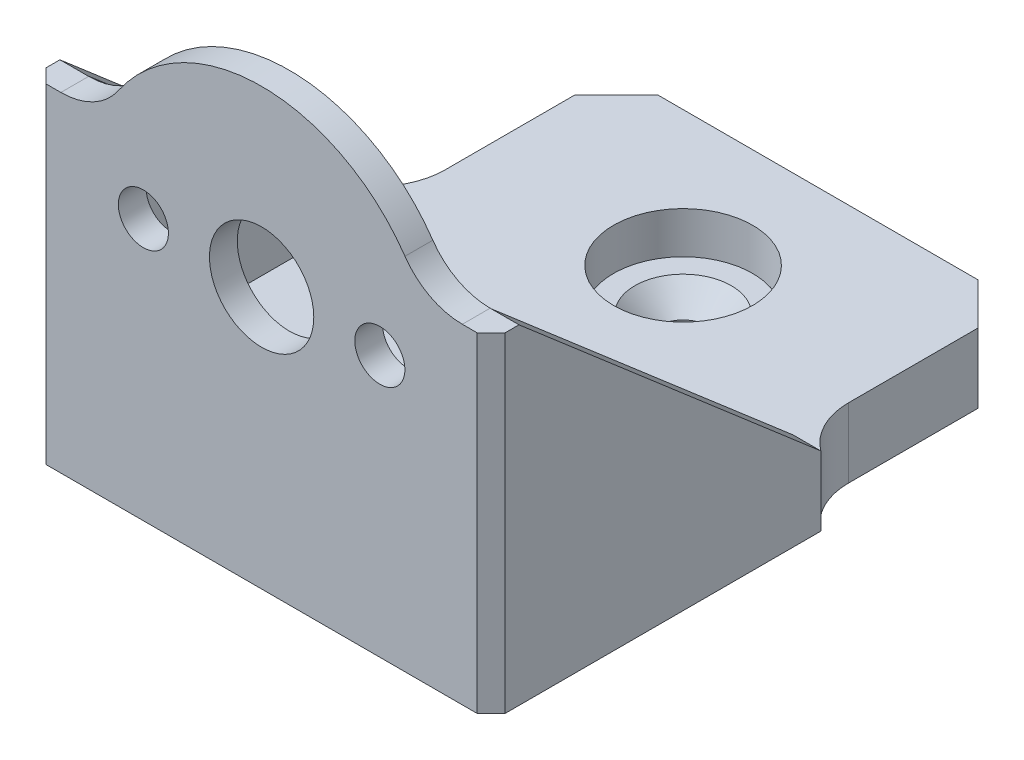
from build123d import *

# Parameters (mm, degrees)
SKETCH1_W                                    = 23
SKETCH1_H                                    = 40
SKETCH1_R                                    = 1.75
BOSS_EXTRUDE1_DEPTH                          = 5
SKETCH2_W                                    = 23
SKETCH2_H                                    = 2
BOSS_EXTRUDE2_DEPTH                          = 50
SKETCH3_R                                    = 1.8
SKETCH3_R_2                                  = 3.75
CUT_EXTRUDE1_DEPTH                           = 69.972820734
BOSS_EXTRUDE3_DEPTH                          = 3
BOSS_EXTRUDE4_START                          = -23
BOSS_EXTRUDE4_DEPTH                          = 3
BOSS_EXTRUDE5_DEPTH                          = 2
BOSS_EXTRUDE6_START                          = -29
BOSS_EXTRUDE6_DEPTH                          = 2
SKETCH6_R                                    = 5
CUT_EXTRUDE2_DEPTH                           = 3
CSK_FOR_M3_HEX_SOCKET_COUNTERSUNK_HE_2_COUNT = 2
CSK_FOR_M3_HEX_SOCKET_COUNTERSUNK_HE_2_PITCH = 20
CHAMFER1_SIZE                                = 3
CHAMFER2_SIZE                                = 1
FILLET1_R                                    = 5


with BuildPart() as part:
    # Sketch1 → Boss-Extrude1 (new body)
    with BuildSketch(Plane(origin=(0, 0, 0), x_dir=(1, 0, 0), z_dir=(0, 1, 0))):
        with Locations((0, -10.3)):
            Rectangle(SKETCH1_W, SKETCH1_H)
        with Locations(Location((0, 0, 0), (0, 0, 270))):
            Circle(SKETCH1_R, mode=Mode.SUBTRACT)
        with Locations(Location((0, -20, 0), (0, 0, 270))):
            Circle(SKETCH1_R, mode=Mode.SUBTRACT)
    extrude(amount=BOSS_EXTRUDE1_DEPTH)

    # Sketch2 → Boss-Extrude2 (add)
    with BuildSketch(Plane(origin=(0, 5, 0), x_dir=(1, 0, 0), z_dir=(0, 1, 0))):
        with Locations((0, -29.3)):
            Rectangle(SKETCH2_W, SKETCH2_H)
    extrude(amount=BOSS_EXTRUDE2_DEPTH)

    # Sketch3 → Cut-Extrude1 (cut, through all)
    with BuildSketch(Plane.XY.offset(30.3)):
        with Locations((-8.5, 18.8)):
            Circle(SKETCH3_R)
        with Locations((8.5, 18.8)):
            Circle(SKETCH3_R)
        with Locations((0, 18.8)):
            Circle(SKETCH3_R_2)
        with BuildLine():
            Line((-11.5, 23.698979486), (-11.5, 55))
            Line((-11.5, 55), (11.5, 55))
            Line((11.5, 55), (11.5, 23.698979486))
            ThreePointArc((11.5, 23.698979486), (0, 31.3), (-11.5, 23.698979486))
        make_face()
    extrude(amount=-CUT_EXTRUDE1_DEPTH, mode=Mode.SUBTRACT)

    # Sketch4 → Boss-Extrude3 (add)
    with BuildSketch(Plane.ZY.offset(11.5)):
        Polygon((30.3, 0), (30.3, 23.698979486), (28.3, 23.698979486), (28.3, 5), (-9.7, 5), (-9.7, 0), align=None)
    extrude(amount=BOSS_EXTRUDE3_DEPTH)

    # Sketch4<2> → Boss-Extrude4 (add)
    with BuildSketch(Plane.ZY.offset(11.5).offset(BOSS_EXTRUDE4_START)):
        Polygon((30.3, 0), (30.3, 23.698979486), (28.3, 23.698979486), (28.3, 5), (-9.7, 5), (-9.7, 0), align=None)
    extrude(amount=-BOSS_EXTRUDE4_DEPTH)

    # Sketch5 → Boss-Extrude5 (add)
    with BuildSketch(Plane(origin=(14.5, 0, 0), x_dir=(0, 0, -1), z_dir=(1, 0, 0))):
        Polygon((-30.3, 23.698979486), (-30.3, 0), (-6.601020514, 0), (-6.601020514, 5), (-28.3, 23.698979486), align=None)
    extrude(amount=BOSS_EXTRUDE5_DEPTH)

    # Sketch5<2> → Boss-Extrude6 (add)
    with BuildSketch(Plane(origin=(14.5, 0, 0), x_dir=(0, 0, -1), z_dir=(1, 0, 0)).offset(BOSS_EXTRUDE6_START)):
        Polygon((-30.3, 23.698979486), (-30.3, 0), (-6.601020514, 0), (-6.601020514, 5), (-28.3, 23.698979486), align=None)
    extrude(amount=-BOSS_EXTRUDE6_DEPTH)

    # Sketch6 → Cut-Extrude2 (cut)
    with BuildSketch(Plane(origin=(0, 5, 0), x_dir=(1, 0, 0), z_dir=(0, 1, 0))):
        with Locations(Location((0, 0, 0), (0, 0, 270))):
            Circle(SKETCH6_R)
        with Locations(Location((0, -20, 0), (0, 0, 270))):
            Circle(SKETCH6_R)
    extrude(amount=-CUT_EXTRUDE2_DEPTH, mode=Mode.SUBTRACT)

    # Sketch8 → CSK for M3 Hex Socket Countersunk Head Screw1 (revolve, cut)
    with BuildSketch(Plane(origin=(0, 2, 0), x_dir=(0, 0, 1), z_dir=(1, 0, 0))):
        Polygon((0, 0), (0, 2), (1.8, 2), (1.8, 1.67), (3.47, 0), align=None)
    csk_for_m3_hex_socket_countersunk_head_s = revolve(axis=Axis((0, 8.35, 0), (0, -1, 0)), mode=Mode.SUBTRACT)

    # CSK for M3 Hex Socket Countersunk He 2: CSK for M3 Hex Socket Countersunk Head Screw1 ×2
    with Locations(*[(0, 0, i * CSK_FOR_M3_HEX_SOCKET_COUNTERSUNK_HE_2_PITCH) for i in range(1, CSK_FOR_M3_HEX_SOCKET_COUNTERSUNK_HE_2_COUNT)]):
        add(csk_for_m3_hex_socket_countersunk_head_s, mode=Mode.SUBTRACT)

    # Chamfer1
    chamfer1_edges = [part.edges().sort_by_distance(p)[0] for p in [
        (-14.5, 2.5, -9.7),
        (14.5, 2.5, -9.7),
    ]]
    chamfer(chamfer1_edges, length=CHAMFER1_SIZE)

    # Chamfer2
    chamfer2_edges = [part.edges().sort_by_distance(p)[0] for p in [
        (16.5, 11.849489743, 30.3),
        (-16.5, 11.849489743, 30.3),
    ]]
    chamfer(chamfer2_edges, length=CHAMFER2_SIZE)

    # Fillet1
    # the kernel refuses this fillet: 5 mm, written as the material it adds along each edge
    with BuildSketch(Plane(origin=(11.5, 23.698979486, 30.3), x_dir=(1, 0, 0), z_dir=(0, 0, -1))) as fillet1_piece_1:
        with BuildLine():
            CenterArc((2.931223273, -5), FILLET1_R, 90, 55.552144514)
            ThreePointArc((-1.191983377, -2.171720147), (-0.54205816, -1.115462354), (0, 0))
            Line((0, 0), (2.931223273, 0))
        make_face()
    extrude(amount=2)
    with BuildSketch(Plane(origin=(-11.5, 23.698979486, 30.3), x_dir=(-1, 0, 0), z_dir=(0, 0, -1))) as fillet1_piece_2:
        with BuildLine():
            CenterArc((2.931223273, 5), FILLET1_R, 214.447855486, 55.552144514)
            ThreePointArc((-1.191983377, 2.171720147), (-0.54205816, 1.115462354), (0, 0))
            Line((0, 0), (2.931223273, 0))
        make_face()
    extrude(amount=2)
    with BuildSketch(Plane(origin=(-14.5, 0, 6.601020514), x_dir=(-1, 0, 0), z_dir=(0, 1, 0))) as fillet1_piece_3:
        with BuildLine():
            CenterArc((5, -4), FILLET1_R, 126.869897646, 53.130102354)
            Line((0, -4), (0, 0))
            Line((0, 0), (2, 0))
        make_face()
    extrude(amount=5)
    with BuildSketch(Plane(origin=(14.5, 0, 6.601020514), x_dir=(1, 0, 0), z_dir=(0, 1, 0))) as fillet1_piece_4:
        with BuildLine():
            CenterArc((5, 4), FILLET1_R, 180, 53.130102354)
            Line((0, 4), (0, 0))
            Line((0, 0), (2, 0))
        make_face()
    extrude(amount=5)


solid = part.part
